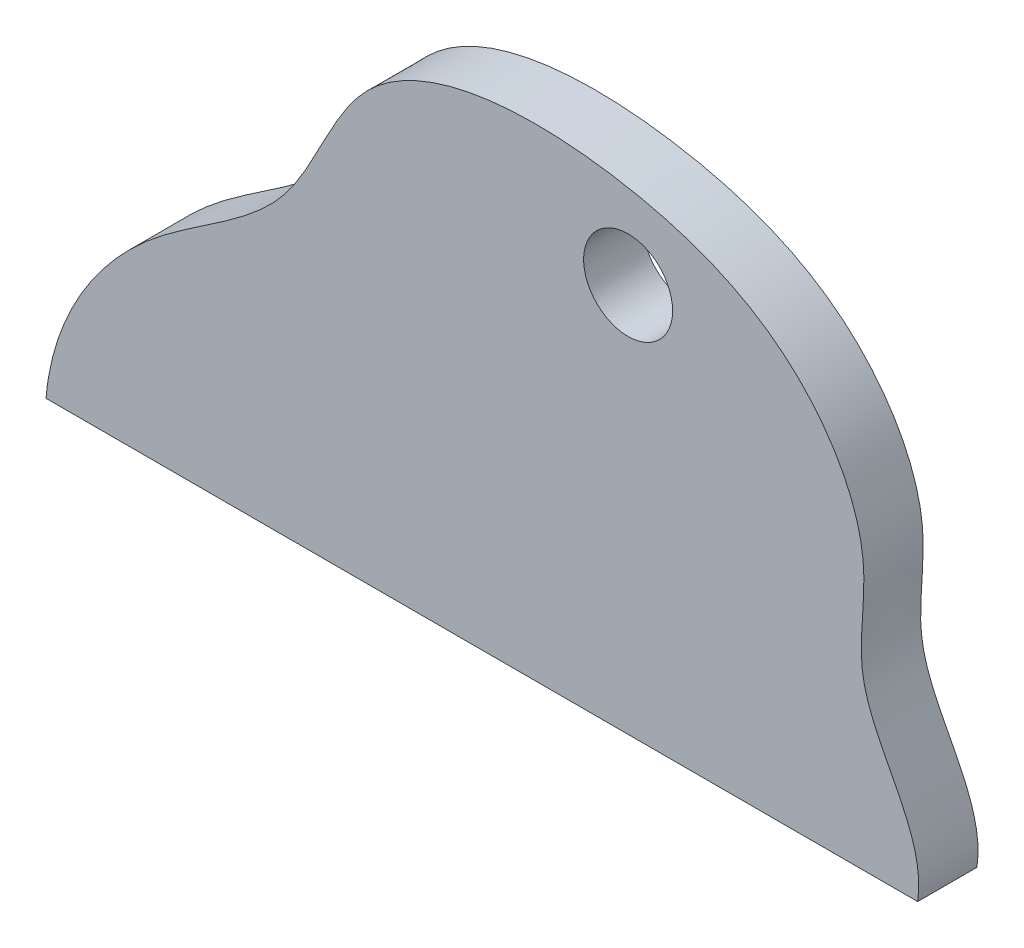
from build123d import *
from OCP.BRepAlgoAPI import BRepAlgoAPI_Cut
from OCP.TopTools import TopTools_ListOfShape

# Parameters (mm, degrees)
SKETCH1_R           = 1.905
BOSS_EXTRUDE1_DEPTH = 4.292022727
SCALE1_SCALE        = 0.739744452
SKETCH2_R           = 2.38125
CUT_EXTRUDE1_DEPTH  = 474.934058965


with BuildPart() as part:
    # Sketch1 → Boss-Extrude1 (new body)
    with BuildSketch(Plane.XY):
        with BuildLine():
            Line((414.664092284, 28.837959437), (477.745187058, 28.837959437))
            add(Edge.make_bspline(
                [(414.664092284, 28.837959437), (415.153200535, 34.395030861), (420.485745831, 42.922593868), (432.858822753, 48.749849518), (437.336668693, 63.812055241), (455.660979606, 64.670643077), (469.273047892, 59.119436778), (474.839401849, 49.066135717), (472.340854494, 38.774622034), (478.419942664, 33.320049008), (477.745187058, 28.837959437)],
                knots=[0, 0, 0, 0, 0.159468666, 0.276152642, 0.381296496, 0.572074307, 0.70916512, 0.806266415, 0.876509393, 1, 1, 1, 1], degree=3))
        make_face()
        with Locations((456.790913361, 56.995264717)):
            Circle(SKETCH1_R, mode=Mode.SUBTRACT)
    extrude(amount=BOSS_EXTRUDE1_DEPTH)


with BuildPart() as part_1:
    # Scale1: scaled about (448.952587877, 43.242185137, 2.146011363)
    add(part.part.scale(SCALE1_SCALE).moved(Location((116.842401821, 11.254018593, 0.558511363))))


with BuildPart() as cut_extrude1_tool:
    # Sketch2 → Cut-Extrude1 (new, through all)
    with BuildSketch(Plane.XY.offset(3.733501485)):
        with Locations((454.750929555, 53.415813648)):
            Circle(SKETCH2_R)
    extrude(amount=-CUT_EXTRUDE1_DEPTH)


with BuildPart() as part_2:
    add(part_1.part)

    # Cut-Extrude1: cut by cut_extrude1_tool, with a tolerance
    cut_extrude1_stock = TopTools_ListOfShape()
    cut_extrude1_stock.Append(part_2.part.wrapped)
    cut_extrude1_tools = TopTools_ListOfShape()
    cut_extrude1_tools.Append(cut_extrude1_tool.part.wrapped)
    cut_extrude1_cut = BRepAlgoAPI_Cut()
    cut_extrude1_cut.SetArguments(cut_extrude1_stock)
    cut_extrude1_cut.SetTools(cut_extrude1_tools)
    cut_extrude1_cut.SetFuzzyValue(0.00001)
    cut_extrude1_cut.Build()
    add(Compound.cast(cut_extrude1_cut.Shape()).solids(), mode=Mode.REPLACE)


solid = part_2.part
